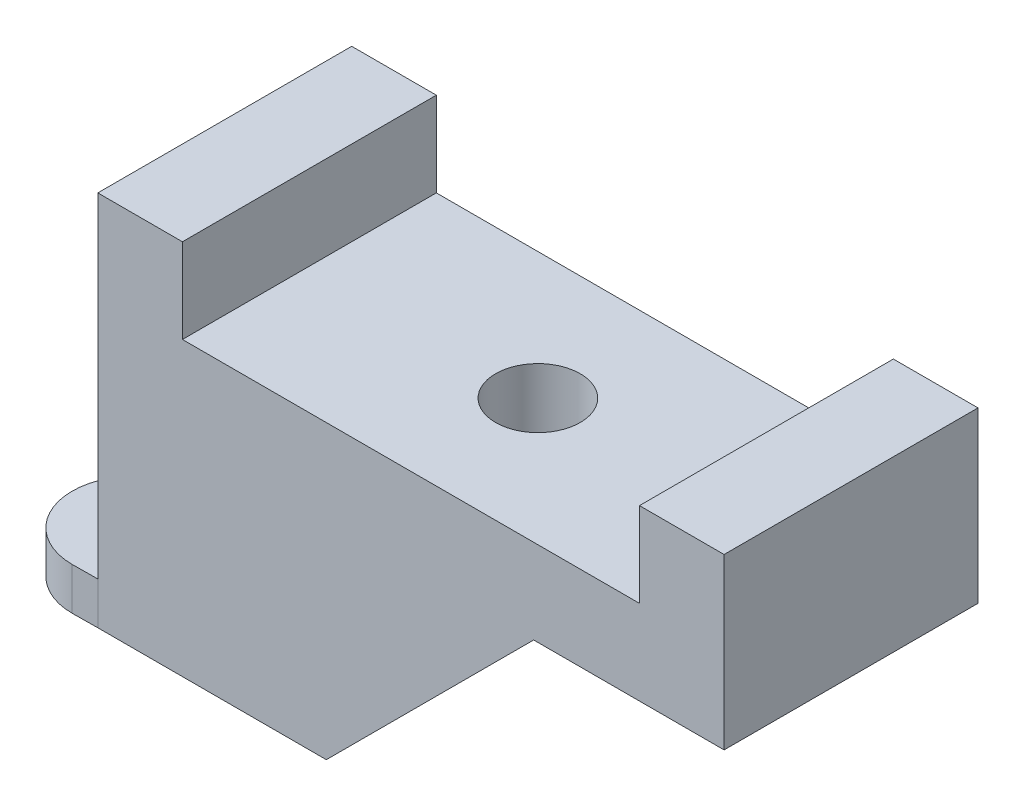
from build123d import *

# Parameters (mm, degrees)
SKETCH1_W               = 22.2
SKETCH1_H               = 9
SKETCH1_R               = 1.5
BOSS_EXTRUDE1_DEPTH     = 3
SKETCH2_W               = 3
SKETCH2_H               = 9
BOSS_EXTRUDE2_DEPTH     = 3
BOSS_EXTRUDE3_START     = -10.35
BOSS_EXTRUDE3_OUTLINE_R = 0.75
BOSS_EXTRUDE3_DEPTH     = 1.5
SKETCH4_W               = 8.1
SKETCH4_H               = 9
BOSS_EXTRUDE4_DEPTH     = 7.35
CHAMFER1_SIZE           = 7.35
CHAMFER2_SIZE           = 4.5
CUT_EXTRUDE1_START      = -3
SKETCH5_R               = 3
CUT_EXTRUDE1_DEPTH      = 16.180349282


# Read off the part's stored shape, not the designer's step: Boss-Extrude3
with BuildPart() as part:
    # Sketch1 → Boss-Extrude1 (new body)
    with BuildSketch(Plane(origin=(0, 0, 0), x_dir=(1, 0, 0), z_dir=(0, 1, 0))):
        Rectangle(SKETCH1_W, SKETCH1_H)
        with Locations(Location((0, 0, 0), (0, 0, 270))):
            Circle(SKETCH1_R, mode=Mode.SUBTRACT)
    extrude(amount=BOSS_EXTRUDE1_DEPTH)

    # Sketch2 → Boss-Extrude2 (add)
    with BuildSketch(Plane(origin=(0, 3, 0), x_dir=(1, 0, 0), z_dir=(0, 1, 0))):
        with Locations((-9.6, 0)):
            Rectangle(SKETCH2_W, SKETCH2_H)
        with Locations((9.6, 0)):
            Rectangle(SKETCH2_W, SKETCH2_H)
    extrude(amount=BOSS_EXTRUDE2_DEPTH)



with BuildPart() as body_2:
    # Boss-Extrude3 outline → Boss-Extrude3 (new body)
    with BuildSketch(Plane(origin=(0, 3, 0), x_dir=(1, 0, 0), z_dir=(0, 1, 0)).offset(BOSS_EXTRUDE3_START)):
        with BuildLine():
            Line((-12, -4.51), (-11.1, -4.5))
            Line((-11.1, -4.5), (-11.1, 0))
            Line((-11.1, 0), (-12, -0.01))
            ThreePointArc((-12, -0.01), (-14.25, -2.26), (-12, -4.51))
        make_face()
        with Locations((-12, -2.26)):
            Circle(BOSS_EXTRUDE3_OUTLINE_R, mode=Mode.SUBTRACT)
    extrude(amount=BOSS_EXTRUDE3_DEPTH)


with BuildPart() as part_1:
    add(part.part)

    add(body_2.part)  # Boss-Extrude4 merges body 2
    # Sketch4 → Boss-Extrude4 (add)
    with BuildSketch(Plane.XZ):
        with Locations((-7.05, 0)):
            Rectangle(SKETCH4_W, SKETCH4_H)
    extrude(amount=BOSS_EXTRUDE4_DEPTH)

    # Chamfer1
    # the kernel refuses this chamfer: 7.35 mm, written as the material it adds along each edge
    with BuildSketch(Plane(origin=(-3, 0, 4.5), x_dir=(0.9996219169112966, 0.027495876610586372, 0), z_dir=(0, 0, -1))) as chamfer1_piece_1_section:
        Polygon((CHAMFER1_SIZE * 0.999621916911, CHAMFER1_SIZE * 0.0274958766106), (-CHAMFER1_SIZE * 0.0274958766106, CHAMFER1_SIZE * 0.999621916911), (0, 0), align=None)
    chamfer1_piece_1 = extrude(amount=9, mode=Mode.PRIVATE)
    chamfer1_piece_1 = chamfer1_piece_1 - Plane(origin=(0, -1.008100378, 0), x_dir=(0, 0, 1), z_dir=(0, -1, 0)) * Cylinder(1.5, 48, mode=Mode.PRIVATE)
    chamfer1_piece_1 = split(chamfer1_piece_1, bisect_by=Plane(origin=(3.254582701, -7.35, -3), z_dir=(0, 1, 0)), keep=Keep.TOP, mode=Mode.PRIVATE)
    add(chamfer1_piece_1)

    # Chamfer2
    chamfer2_edges = [part_1.edges().sort_by_distance(p)[0] for p in [
        (-7.05, -7.35, -4.5),
    ]]
    chamfer(chamfer2_edges, length=CHAMFER2_SIZE)

    # Sketch5 → Cut-Extrude1 (cut, through all)
    with BuildSketch(Plane(origin=(0, 3, 0), x_dir=(1, 0, 0), z_dir=(0, 1, 0)).offset(CUT_EXTRUDE1_START)):
        with Locations(Location((0, 0, 0), (0, 0, 270))):
            Circle(SKETCH5_R)
    extrude(amount=-CUT_EXTRUDE1_DEPTH, mode=Mode.SUBTRACT)


solid = part_1.part
